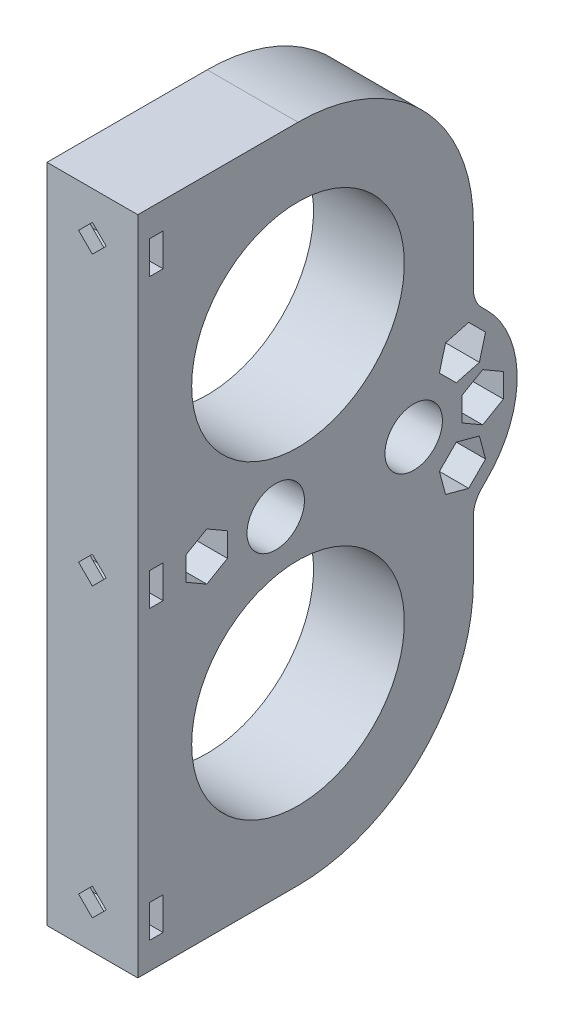
from build123d import *
from build123d.topology import SkipClean

# Parameters (mm, degrees)
BOSS_EXTRUDE1_DEPTH     = 8
CUT_EXTRUDE1_DEPTH      = 78.453287602
CUT_EXTRUDE1_DEPTH_BACK = 70.453287602
CUT_EXTRUDE1_START      = -8
SKETCH9_R               = 5
CUT_EXTRUDE2_DEPTH      = 70.453287602
CUT_EXTRUDE2_DEPTH_BACK = 70.453287602
CUT_EXTRUDE3_DEPTH      = 70.453287602
CUT_EXTRUDE3_DEPTH_BACK = 70.453287602
SKETCH11_R              = 18.5
CUT_EXTRUDE4_DEPTH      = 70.453287602
CUT_EXTRUDE4_DEPTH_BACK = 70.453287602
SKETCH12_W              = 5.7
SKETCH12_H              = 2.4
CUT_EXTRUDE5_START      = 27.875085
CUT_EXTRUDE5_DEPTH      = 6
MOVE_START              = -8
MOVE_FACE1_OUTLINE_W    = 5.7
MOVE_FACE1_OUTLINE_H    = 2.4
MOVE_FACE1_OUTLINE_R    = 18.5
MOVE_FACE1_DEPTH        = 0.1
MOVE_START_2            = 7.9
MOVE_FACE1_2_OUTLINE_W  = 5.7
MOVE_FACE1_2_OUTLINE_H  = 2.4
MOVE_FACE1_2_OUTLINE_R  = 18.5
MOVE_FACE1_2_DEPTH      = 0.1


# Read off the part's stored shape, not the designer's step: Move Face1
with BuildPart() as part:
    # Sketch2 → Boss-Extrude1 (new, symmetric)
    with BuildSketch(Plane.YZ):
        with BuildLine():
            Line((-12.727922061, -32.852837258), (-13.616293225, -31.964466094))
            ThreePointArc((-13.616293225, -31.964466094), (-15.238409969, -30.880602337), (-17.151827131, -30.5))
            Line((-17.151827131, -30.5), (-27, -30.5))
            ThreePointArc((-27, -30.5), (-48.566756826, -21.566756826), (-57.5, 0))
            Line((-57.5, 0), (-57.5, 27.875084803))
            Line((-57.5, 27.875084803), (0, 27.875084803))
            Line((0, 27.875084803), (0, -38.124915197))
            ThreePointArc((0, -38.124915197), (-6.888301783, -36.754746782), (-12.727922061, -32.852837258))
        make_face()
    extrude(amount=BOSS_EXTRUDE1_DEPTH, both=True)

    # Sketch9 → Cut-Extrude1 (cut, two sides: drawn at the far end of the back side and taken through both)
    with BuildSketch(Plane.YZ.offset(CUT_EXTRUDE1_START - CUT_EXTRUDE1_DEPTH_BACK)):
        with Locations((0, 3.875084803)):
            Circle(SKETCH9_R)
        with Locations((0, -20.124915197)):
            Circle(SKETCH9_R)
    extrude(amount=CUT_EXTRUDE1_DEPTH + CUT_EXTRUDE1_DEPTH_BACK, mode=Mode.SUBTRACT)

    # Sketch10 → Cut-Extrude2 (cut, two sides: drawn at the far end of the back side and taken through both)
    with BuildSketch(Plane.YZ.offset(-CUT_EXTRUDE2_DEPTH_BACK)):
        Polygon((2.078460969, 12.275084803), (4.156921938, 15.875084803), (2.078460969, 19.475084803), (-2.078460969, 19.475084803), (-4.156921938, 15.875084803), (-2.078460969, 12.275084803), align=None)
        Polygon((-5.545893683, -31.549584262), (-4.470003116, -27.534306004), (-7.409390808, -24.594918313), (-11.424669066, -25.67080888), (-12.500559632, -29.686087138), (-9.561171941, -32.625474829), align=None)
        Polygon((4.156921938, -32.124915197), (2.078460969, -28.524915197), (-2.078460969, -28.524915197), (-4.156921938, -32.124915197), (-2.078460969, -35.724915197), (2.078460969, -35.724915197), align=None)
        Polygon((12.500559632, -29.686087138), (11.424669066, -25.67080888), (7.409390808, -24.594918313), (4.470003116, -27.534306004), (5.545893683, -31.549584262), (9.561171941, -32.625474829), align=None)
    extrude(amount=CUT_EXTRUDE2_DEPTH + CUT_EXTRUDE2_DEPTH_BACK, mode=Mode.SUBTRACT)

    # Sketch11 → Cut-Extrude3 (cut, two sides: drawn at the far end of the back side and taken through both)
    with BuildSketch(Plane.YZ.offset(-CUT_EXTRUDE3_DEPTH_BACK)):
        with Locations(Location((-27, 0, 0), (0, 0, 270))):
            Circle(SKETCH11_R)
    extrude(amount=CUT_EXTRUDE3_DEPTH + CUT_EXTRUDE3_DEPTH_BACK, mode=Mode.SUBTRACT)

    # Sketch12 → Cut-Extrude4 (cut, two sides: drawn at the far end of the back side and taken through both)
    with BuildSketch(Plane.YZ.offset(-CUT_EXTRUDE4_DEPTH_BACK)):
        with Locations((-50, 24.675084803)):
            Rectangle(SKETCH12_W, SKETCH12_H)
        with Locations((0, 24.675084803)):
            Rectangle(SKETCH12_W, SKETCH12_H)
    extrude(amount=CUT_EXTRUDE4_DEPTH + CUT_EXTRUDE4_DEPTH_BACK, mode=Mode.SUBTRACT)

    # Sketch13 → Cut-Extrude5 (cut)
    with BuildSketch(Plane.XY.offset(CUT_EXTRUDE5_START)):
        Polygon((0, -2.404163056), (2.404163056, 0), (0, 2.404163056), (-2.404163056, 0), align=None)
        Polygon((0, -52.404163056), (2.404163056, -50), (0, -47.595836944), (-2.404163056, -50), align=None)
    extrude(amount=-CUT_EXTRUDE5_DEPTH, mode=Mode.SUBTRACT)

    # Move Face1 outline → Move Face1 (cut)
    with BuildSketch(Plane.YZ.offset(MOVE_START)):
        with BuildLine():
            Line((-2.85, 25.875084803), (0, 25.875084803))
            Line((0, 25.875084803), (0, 27.875084803))
            Line((0, 27.875084803), (-57.5, 27.875084803))
            Line((-57.5, 27.875084803), (-57.5, 0))
            ThreePointArc((-57.5, 0), (-48.566756826, -21.566756826), (-27, -30.5))
            Line((-27, -30.5), (-17.151827131, -30.5))
            ThreePointArc((-17.151827131, -30.5), (-15.238409969, -30.880602337), (-13.616293225, -31.964466094))
            Line((-13.616293225, -31.964466094), (-12.727922061, -32.852837258))
            ThreePointArc((-12.727922061, -32.852837258), (-6.888301783, -36.754746782), (0, -38.124915197))
            Line((0, -38.124915197), (0, -35.724915197))
            Line((0, -35.724915197), (-2.078460969, -35.724915197))
            Line((-2.078460969, -35.724915197), (-4.156921938, -32.124915197))
            Line((-4.156921938, -32.124915197), (-2.078460969, -28.524915197))
            Line((-2.078460969, -28.524915197), (0, -28.524915197))
            Line((0, -28.524915197), (0, -25.124915197))
            ThreePointArc((0, -25.124915197), (-5, -20.124915197), (0, -15.124915197))
            Line((0, -15.124915197), (0, -1.124915197))
            ThreePointArc((0, -1.124915197), (-5, 3.875084803), (0, 8.875084803))
            Line((0, 8.875084803), (0, 12.275084803))
            Line((0, 12.275084803), (-2.078460969, 12.275084803))
            Line((-2.078460969, 12.275084803), (-4.156921938, 15.875084803))
            Line((-4.156921938, 15.875084803), (-2.078460969, 19.475084803))
            Line((-2.078460969, 19.475084803), (0, 19.475084803))
            Line((0, 19.475084803), (0, 23.475084803))
            Line((0, 23.475084803), (-2.85, 23.475084803))
            Line((-2.85, 23.475084803), (-2.85, 25.875084803))
        make_face()
        Polygon((-5.545893683, -31.549584262), (-9.561171941, -32.625474829), (-12.500559632, -29.686087138), (-11.424669066, -25.67080888), (-7.409390808, -24.594918313), (-4.470003116, -27.534306004), align=None, mode=Mode.SUBTRACT)
        with Locations((-50, 24.675084803)):
            Rectangle(MOVE_FACE1_OUTLINE_W, MOVE_FACE1_OUTLINE_H, mode=Mode.SUBTRACT)
        with Locations((-27, 0)):
            Circle(MOVE_FACE1_OUTLINE_R, mode=Mode.SUBTRACT)
    extrude(amount=MOVE_FACE1_DEPTH, mode=Mode.SUBTRACT)

    # Move Face1 2 outline → Move Face1 2 (cut)
    with BuildSketch(Plane.YZ.offset(MOVE_START_2)):
        with BuildLine():
            Line((-2.85, 25.875084803), (0, 25.875084803))
            Line((0, 25.875084803), (0, 27.875084803))
            Line((0, 27.875084803), (-57.5, 27.875084803))
            Line((-57.5, 27.875084803), (-57.5, 0))
            ThreePointArc((-57.5, 0), (-48.566756826, -21.566756826), (-27, -30.5))
            Line((-27, -30.5), (-17.151827131, -30.5))
            ThreePointArc((-17.151827131, -30.5), (-15.238409969, -30.880602337), (-13.616293225, -31.964466094))
            Line((-13.616293225, -31.964466094), (-12.727922061, -32.852837258))
            ThreePointArc((-12.727922061, -32.852837258), (-6.888301783, -36.754746782), (0, -38.124915197))
            Line((0, -38.124915197), (0, -35.724915197))
            Line((0, -35.724915197), (-2.078460969, -35.724915197))
            Line((-2.078460969, -35.724915197), (-4.156921938, -32.124915197))
            Line((-4.156921938, -32.124915197), (-2.078460969, -28.524915197))
            Line((-2.078460969, -28.524915197), (0, -28.524915197))
            Line((0, -28.524915197), (0, -25.124915197))
            ThreePointArc((0, -25.124915197), (-5, -20.124915197), (0, -15.124915197))
            Line((0, -15.124915197), (0, -1.124915197))
            ThreePointArc((0, -1.124915197), (-5, 3.875084803), (0, 8.875084803))
            Line((0, 8.875084803), (0, 12.275084803))
            Line((0, 12.275084803), (-2.078460969, 12.275084803))
            Line((-2.078460969, 12.275084803), (-4.156921938, 15.875084803))
            Line((-4.156921938, 15.875084803), (-2.078460969, 19.475084803))
            Line((-2.078460969, 19.475084803), (0, 19.475084803))
            Line((0, 19.475084803), (0, 23.475084803))
            Line((0, 23.475084803), (-2.85, 23.475084803))
            Line((-2.85, 23.475084803), (-2.85, 25.875084803))
        make_face()
        Polygon((-5.545893683, -31.549584262), (-9.561171941, -32.625474829), (-12.500559632, -29.686087138), (-11.424669066, -25.67080888), (-7.409390808, -24.594918313), (-4.470003116, -27.534306004), align=None, mode=Mode.SUBTRACT)
        with Locations((-50, 24.675084803)):
            Rectangle(MOVE_FACE1_2_OUTLINE_W, MOVE_FACE1_2_OUTLINE_H, mode=Mode.SUBTRACT)
        with Locations((-27, 0)):
            Circle(MOVE_FACE1_2_OUTLINE_R, mode=Mode.SUBTRACT)
    extrude(amount=MOVE_FACE1_2_DEPTH, mode=Mode.SUBTRACT)

    # Mirror1: part across plane


with BuildPart() as part_1:
    with SkipClean():  # the faces are left unmerged after this step: merging them gives an invalid solid
        add(part.part)
        add(part.part.mirror(Plane(origin=(0, 0, 0), x_dir=(0, 0, 1), z_dir=(0, -1, 0))))


solid = part_1.part
